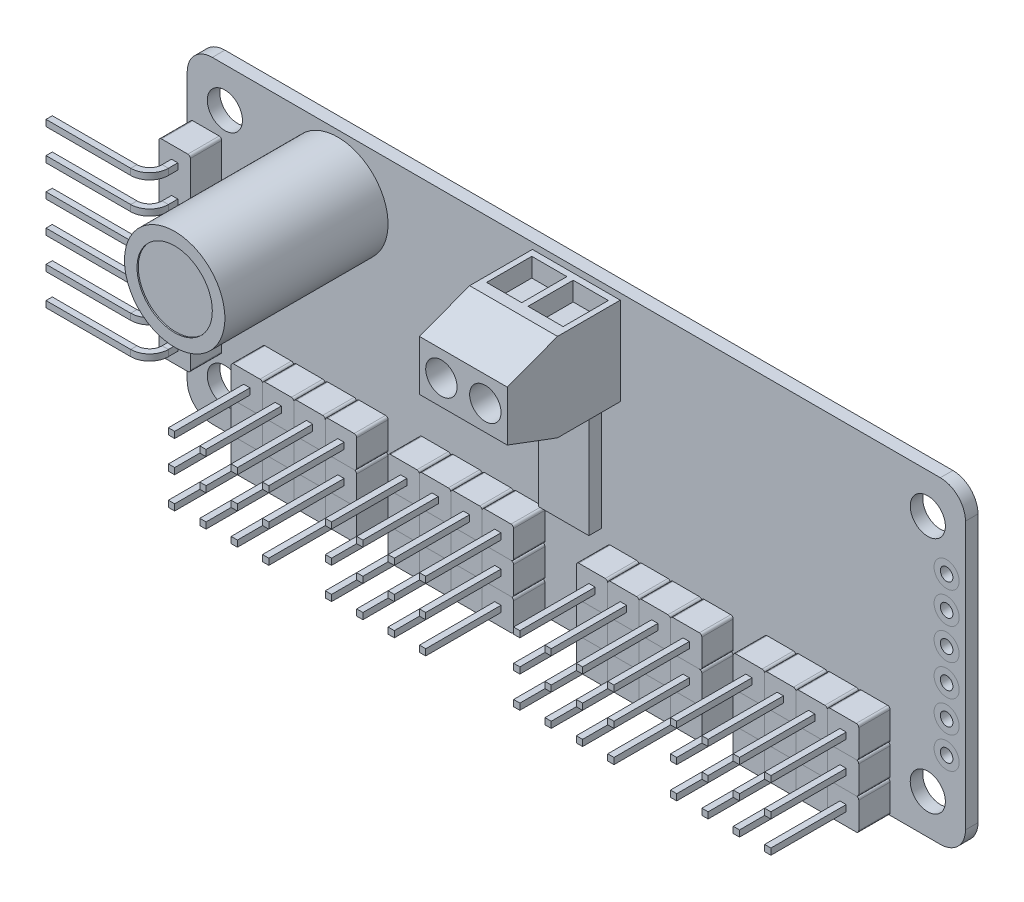
from build123d import *

# Parameters (mm, degrees)
SKETCH1_R           = 1.4
BOSS_EXTRUDE1_DEPTH = 1
BOSS_EXTRUDE2_DEPTH = 2.5
BOSS_EXTRUDE3_START = -27.5
BOSS_EXTRUDE3_DEPTH = 7
CUT_EXTRUDE1_DEPTH  = 2.5
CUT_EXTRUDE2_START  = 7.3
CUT_EXTRUDE2_DEPTH  = 0.2
SKETCH7_W           = 2.8
SKETCH7_H           = 3.6
CUT_EXTRUDE3_DEPTH  = 1.5
BOSS_EXTRUDE4_START = -4.5
SKETCH8_W           = 0.5
SKETCH8_H           = 0.5
BOSS_EXTRUDE4_DEPTH = 10.5
SKETCH9_W           = 4
SKETCH9_H           = 9
BOSS_EXTRUDE5_DEPTH = 1
SKETCH10_R          = 4
BOSS_EXTRUDE6_DEPTH = 13
SKETCH11_R          = 3
CUT_EXTRUDE4_DEPTH  = 0.1
BOSS_EXTRUDE7_DEPTH = 2.5
SKETCH14_W          = 0.5
SKETCH14_H          = 0.5
SKETCH15_R          = 0.5
CUT_EXTRUDE5_DEPTH  = 42.656602118


# Read off the part's stored shape, not the designer's step: Cut-Extrude2
with BuildPart() as part:
    # Sketch1 → Boss-Extrude1 (new body)
    with BuildSketch(Plane.XY):
        with BuildLine():
            Line((-29, -12.65), (29, -12.65))
            ThreePointArc((29, -12.65), (30.414213562, -12.064213562), (31, -10.65))
            Line((31, -10.65), (31, 10.65))
            ThreePointArc((31, 10.65), (30.414213562, 12.064213562), (29, 12.65))
            Line((29, 12.65), (-29, 12.65))
            ThreePointArc((-29, 12.65), (-30.414213562, 12.064213562), (-31, 10.65))
            Line((-31, 10.65), (-31, -10.65))
            ThreePointArc((-31, -10.65), (-30.414213562, -12.064213562), (-29, -12.65))
        make_face()
        with Locations((-28, 9.5)):
            Circle(SKETCH1_R, mode=Mode.SUBTRACT)
        with Locations((28, 9.5)):
            Circle(SKETCH1_R, mode=Mode.SUBTRACT)
        with Locations(Location((28, -9.5, 0), (0, 0, 180))):
            Circle(SKETCH1_R, mode=Mode.SUBTRACT)
        with Locations(Location((-28, -9.5, 0), (0, 0, 180))):
            Circle(SKETCH1_R, mode=Mode.SUBTRACT)
    extrude(amount=BOSS_EXTRUDE1_DEPTH)

    # Sketch2 → Boss-Extrude2 (add)
    with BuildSketch(Plane.XY.offset(1)):
        with BuildLine():
            ThreePointArc((-22.7, -5.15), (-22.558578644, -5.208578644), (-22.5, -5.35))
            Line((-22.5, -5.35), (-22.5, -7.45))
            ThreePointArc((-22.5, -7.45), (-22.558578644, -7.591421356), (-22.7, -7.65))
            Line((-22.7, -7.65), (-24.8, -7.65))
            ThreePointArc((-24.8, -7.65), (-24.941421356, -7.591421356), (-25, -7.45))
            Line((-25, -7.45), (-25, -5.35))
            ThreePointArc((-25, -5.35), (-24.941421356, -5.208578644), (-24.8, -5.15))
            Line((-24.8, -5.15), (-22.7, -5.15))
        make_face()
        with BuildLine():
            ThreePointArc((-20.2, -5.15), (-20.058578644, -5.208578644), (-20, -5.35))
            Line((-20, -5.35), (-20, -7.45))
            ThreePointArc((-20, -7.45), (-20.058578644, -7.591421356), (-20.2, -7.65))
            Line((-20.2, -7.65), (-22.3, -7.65))
            ThreePointArc((-22.3, -7.65), (-22.441421356, -7.591421356), (-22.5, -7.45))
            Line((-22.5, -7.45), (-22.5, -5.35))
            ThreePointArc((-22.5, -5.35), (-22.441421356, -5.208578644), (-22.3, -5.15))
            Line((-22.3, -5.15), (-20.2, -5.15))
        make_face()
        with BuildLine():
            ThreePointArc((-22.7, -7.65), (-22.558578644, -7.708578644), (-22.5, -7.85))
            Line((-22.5, -7.85), (-22.5, -9.95))
            ThreePointArc((-22.5, -9.95), (-22.558578644, -10.091421356), (-22.7, -10.15))
            Line((-22.7, -10.15), (-24.8, -10.15))
            ThreePointArc((-24.8, -10.15), (-24.941421356, -10.091421356), (-25, -9.95))
            Line((-25, -9.95), (-25, -7.85))
            ThreePointArc((-25, -7.85), (-24.941421356, -7.708578644), (-24.8, -7.65))
            Line((-24.8, -7.65), (-22.7, -7.65))
        make_face()
        with BuildLine():
            ThreePointArc((-20.2, -7.65), (-20.058578644, -7.708578644), (-20, -7.85))
            Line((-20, -7.85), (-20, -9.95))
            ThreePointArc((-20, -9.95), (-20.058578644, -10.091421356), (-20.2, -10.15))
            Line((-20.2, -10.15), (-22.3, -10.15))
            ThreePointArc((-22.3, -10.15), (-22.441421356, -10.091421356), (-22.5, -9.95))
            Line((-22.5, -9.95), (-22.5, -7.85))
            ThreePointArc((-22.5, -7.85), (-22.441421356, -7.708578644), (-22.3, -7.65))
            Line((-22.3, -7.65), (-20.2, -7.65))
        make_face()
        with BuildLine():
            ThreePointArc((-22.7, -12.65), (-22.558578644, -12.591421356), (-22.5, -12.45))
            Line((-22.5, -12.45), (-22.5, -10.35))
            ThreePointArc((-22.5, -10.35), (-22.558578644, -10.208578644), (-22.7, -10.15))
            Line((-22.7, -10.15), (-24.8, -10.15))
            ThreePointArc((-24.8, -10.15), (-24.941421356, -10.208578644), (-25, -10.35))
            Line((-25, -10.35), (-25, -12.45))
            ThreePointArc((-25, -12.45), (-24.941421356, -12.591421356), (-24.8, -12.65))
            Line((-24.8, -12.65), (-22.7, -12.65))
        make_face()
        with BuildLine():
            Line((-22.5, -10.35), (-22.5, -12.45))
            ThreePointArc((-22.5, -12.45), (-22.441421356, -12.591421356), (-22.3, -12.65))
            Line((-22.3, -12.65), (-20.2, -12.65))
            ThreePointArc((-20.2, -12.65), (-20.058578644, -12.591421356), (-20, -12.45))
            Line((-20, -12.45), (-20, -10.35))
            ThreePointArc((-20, -10.35), (-20.058578644, -10.208578644), (-20.2, -10.15))
            Line((-20.2, -10.15), (-22.3, -10.15))
            ThreePointArc((-22.3, -10.15), (-22.441421356, -10.208578644), (-22.5, -10.35))
        make_face()
        with BuildLine():
            Line((-20, -10.35), (-20, -12.45))
            ThreePointArc((-20, -12.45), (-19.941421356, -12.591421356), (-19.8, -12.65))
            Line((-19.8, -12.65), (-17.7, -12.65))
            ThreePointArc((-17.7, -12.65), (-17.558578644, -12.591421356), (-17.5, -12.45))
            Line((-17.5, -12.45), (-17.5, -10.35))
            ThreePointArc((-17.5, -10.35), (-17.558578644, -10.208578644), (-17.7, -10.15))
            Line((-17.7, -10.15), (-19.8, -10.15))
            ThreePointArc((-19.8, -10.15), (-19.941421356, -10.208578644), (-20, -10.35))
        make_face()
        with BuildLine():
            Line((-17.5, -10.35), (-17.5, -12.45))
            ThreePointArc((-17.5, -12.45), (-17.441421356, -12.591421356), (-17.3, -12.65))
            Line((-17.3, -12.65), (-15.2, -12.65))
            ThreePointArc((-15.2, -12.65), (-15.058578644, -12.591421356), (-15, -12.45))
            Line((-15, -12.45), (-15, -10.35))
            ThreePointArc((-15, -10.35), (-15.058578644, -10.208578644), (-15.2, -10.15))
            Line((-15.2, -10.15), (-17.3, -10.15))
            ThreePointArc((-17.3, -10.15), (-17.441421356, -10.208578644), (-17.5, -10.35))
        make_face()
        with BuildLine():
            ThreePointArc((-15.2, -7.65), (-15.058578644, -7.708578644), (-15, -7.85))
            Line((-15, -7.85), (-15, -9.95))
            ThreePointArc((-15, -9.95), (-15.058578644, -10.091421356), (-15.2, -10.15))
            Line((-15.2, -10.15), (-17.3, -10.15))
            ThreePointArc((-17.3, -10.15), (-17.441421356, -10.091421356), (-17.5, -9.95))
            Line((-17.5, -9.95), (-17.5, -7.85))
            ThreePointArc((-17.5, -7.85), (-17.441421356, -7.708578644), (-17.3, -7.65))
            Line((-17.3, -7.65), (-15.2, -7.65))
        make_face()
        with BuildLine():
            ThreePointArc((-17.7, -7.65), (-17.558578644, -7.708578644), (-17.5, -7.85))
            Line((-17.5, -7.85), (-17.5, -9.95))
            ThreePointArc((-17.5, -9.95), (-17.558578644, -10.091421356), (-17.7, -10.15))
            Line((-17.7, -10.15), (-19.8, -10.15))
            ThreePointArc((-19.8, -10.15), (-19.941421356, -10.091421356), (-20, -9.95))
            Line((-20, -9.95), (-20, -7.85))
            ThreePointArc((-20, -7.85), (-19.941421356, -7.708578644), (-19.8, -7.65))
            Line((-19.8, -7.65), (-17.7, -7.65))
        make_face()
        with BuildLine():
            ThreePointArc((-17.7, -5.15), (-17.558578644, -5.208578644), (-17.5, -5.35))
            Line((-17.5, -5.35), (-17.5, -7.45))
            ThreePointArc((-17.5, -7.45), (-17.558578644, -7.591421356), (-17.7, -7.65))
            Line((-17.7, -7.65), (-19.8, -7.65))
            ThreePointArc((-19.8, -7.65), (-19.941421356, -7.591421356), (-20, -7.45))
            Line((-20, -7.45), (-20, -5.35))
            ThreePointArc((-20, -5.35), (-19.941421356, -5.208578644), (-19.8, -5.15))
            Line((-19.8, -5.15), (-17.7, -5.15))
        make_face()
        with BuildLine():
            ThreePointArc((-15.2, -5.15), (-15.058578644, -5.208578644), (-15, -5.35))
            Line((-15, -5.35), (-15, -7.45))
            ThreePointArc((-15, -7.45), (-15.058578644, -7.591421356), (-15.2, -7.65))
            Line((-15.2, -7.65), (-17.3, -7.65))
            ThreePointArc((-17.3, -7.65), (-17.441421356, -7.591421356), (-17.5, -7.45))
            Line((-17.5, -7.45), (-17.5, -5.35))
            ThreePointArc((-17.5, -5.35), (-17.441421356, -5.208578644), (-17.3, -5.15))
            Line((-17.3, -5.15), (-15.2, -5.15))
        make_face()
        with BuildLine():
            Line((-10, -7.45), (-10, -5.35))
            ThreePointArc((-10, -5.35), (-10.058578644, -5.208578644), (-10.2, -5.15))
            Line((-10.2, -5.15), (-12.3, -5.15))
            ThreePointArc((-12.3, -5.15), (-12.441421356, -5.208578644), (-12.5, -5.35))
            Line((-12.5, -5.35), (-12.5, -7.45))
            ThreePointArc((-12.5, -7.45), (-12.441421356, -7.591421356), (-12.3, -7.65))
            Line((-12.3, -7.65), (-10.2, -7.65))
            ThreePointArc((-10.2, -7.65), (-10.058578644, -7.591421356), (-10, -7.45))
        make_face()
        with BuildLine():
            Line((-10, -9.95), (-10, -7.85))
            ThreePointArc((-10, -7.85), (-10.058578644, -7.708578644), (-10.2, -7.65))
            Line((-10.2, -7.65), (-12.3, -7.65))
            ThreePointArc((-12.3, -7.65), (-12.441421356, -7.708578644), (-12.5, -7.85))
            Line((-12.5, -7.85), (-12.5, -9.95))
            ThreePointArc((-12.5, -9.95), (-12.441421356, -10.091421356), (-12.3, -10.15))
            Line((-12.3, -10.15), (-10.2, -10.15))
            ThreePointArc((-10.2, -10.15), (-10.058578644, -10.091421356), (-10, -9.95))
        make_face()
        with BuildLine():
            ThreePointArc((-12.5, -12.45), (-12.441421356, -12.591421356), (-12.3, -12.65))
            Line((-12.3, -12.65), (-10.2, -12.65))
            ThreePointArc((-10.2, -12.65), (-10.058578644, -12.591421356), (-10, -12.45))
            Line((-10, -12.45), (-10, -10.35))
            ThreePointArc((-10, -10.35), (-10.058578644, -10.208578644), (-10.2, -10.15))
            Line((-10.2, -10.15), (-12.3, -10.15))
            ThreePointArc((-12.3, -10.15), (-12.441421356, -10.208578644), (-12.5, -10.35))
            Line((-12.5, -10.35), (-12.5, -12.45))
        make_face()
        with BuildLine():
            Line((-10, -10.35), (-10, -12.45))
            ThreePointArc((-10, -12.45), (-9.941421356, -12.591421356), (-9.8, -12.65))
            Line((-9.8, -12.65), (-7.7, -12.65))
            ThreePointArc((-7.7, -12.65), (-7.558578644, -12.591421356), (-7.5, -12.45))
            Line((-7.5, -12.45), (-7.5, -10.35))
            ThreePointArc((-7.5, -10.35), (-7.558578644, -10.208578644), (-7.7, -10.15))
            Line((-7.7, -10.15), (-9.8, -10.15))
            ThreePointArc((-9.8, -10.15), (-9.941421356, -10.208578644), (-10, -10.35))
        make_face()
        with BuildLine():
            Line((-7.5, -10.35), (-7.5, -12.45))
            ThreePointArc((-7.5, -12.45), (-7.441421356, -12.591421356), (-7.3, -12.65))
            Line((-7.3, -12.65), (-5.2, -12.65))
            ThreePointArc((-5.2, -12.65), (-5.058578644, -12.591421356), (-5, -12.45))
            Line((-5, -12.45), (-5, -10.35))
            ThreePointArc((-5, -10.35), (-5.058578644, -10.208578644), (-5.2, -10.15))
            Line((-5.2, -10.15), (-7.3, -10.15))
            ThreePointArc((-7.3, -10.15), (-7.441421356, -10.208578644), (-7.5, -10.35))
        make_face()
        with BuildLine():
            Line((-5, -10.35), (-5, -12.45))
            ThreePointArc((-5, -12.45), (-4.941421356, -12.591421356), (-4.8, -12.65))
            Line((-4.8, -12.65), (-2.7, -12.65))
            ThreePointArc((-2.7, -12.65), (-2.558578644, -12.591421356), (-2.5, -12.45))
            Line((-2.5, -12.45), (-2.5, -10.35))
            ThreePointArc((-2.5, -10.35), (-2.558578644, -10.208578644), (-2.7, -10.15))
            Line((-2.7, -10.15), (-4.8, -10.15))
            ThreePointArc((-4.8, -10.15), (-4.941421356, -10.208578644), (-5, -10.35))
        make_face()
        with BuildLine():
            Line((-2.5, -9.95), (-2.5, -7.85))
            ThreePointArc((-2.5, -7.85), (-2.558578644, -7.708578644), (-2.7, -7.65))
            Line((-2.7, -7.65), (-4.8, -7.65))
            ThreePointArc((-4.8, -7.65), (-4.941421356, -7.708578644), (-5, -7.85))
            Line((-5, -7.85), (-5, -9.95))
            ThreePointArc((-5, -9.95), (-4.941421356, -10.091421356), (-4.8, -10.15))
            Line((-4.8, -10.15), (-2.7, -10.15))
            ThreePointArc((-2.7, -10.15), (-2.558578644, -10.091421356), (-2.5, -9.95))
        make_face()
        with BuildLine():
            Line((-5, -9.95), (-5, -7.85))
            ThreePointArc((-5, -7.85), (-5.058578644, -7.708578644), (-5.2, -7.65))
            Line((-5.2, -7.65), (-7.3, -7.65))
            ThreePointArc((-7.3, -7.65), (-7.441421356, -7.708578644), (-7.5, -7.85))
            Line((-7.5, -7.85), (-7.5, -9.95))
            ThreePointArc((-7.5, -9.95), (-7.441421356, -10.091421356), (-7.3, -10.15))
            Line((-7.3, -10.15), (-5.2, -10.15))
            ThreePointArc((-5.2, -10.15), (-5.058578644, -10.091421356), (-5, -9.95))
        make_face()
        with BuildLine():
            Line((-7.5, -9.95), (-7.5, -7.85))
            ThreePointArc((-7.5, -7.85), (-7.558578644, -7.708578644), (-7.7, -7.65))
            Line((-7.7, -7.65), (-9.8, -7.65))
            ThreePointArc((-9.8, -7.65), (-9.941421356, -7.708578644), (-10, -7.85))
            Line((-10, -7.85), (-10, -9.95))
            ThreePointArc((-10, -9.95), (-9.941421356, -10.091421356), (-9.8, -10.15))
            Line((-9.8, -10.15), (-7.7, -10.15))
            ThreePointArc((-7.7, -10.15), (-7.558578644, -10.091421356), (-7.5, -9.95))
        make_face()
        with BuildLine():
            Line((-7.5, -7.45), (-7.5, -5.35))
            ThreePointArc((-7.5, -5.35), (-7.558578644, -5.208578644), (-7.7, -5.15))
            Line((-7.7, -5.15), (-9.8, -5.15))
            ThreePointArc((-9.8, -5.15), (-9.941421356, -5.208578644), (-10, -5.35))
            Line((-10, -5.35), (-10, -7.45))
            ThreePointArc((-10, -7.45), (-9.941421356, -7.591421356), (-9.8, -7.65))
            Line((-9.8, -7.65), (-7.7, -7.65))
            ThreePointArc((-7.7, -7.65), (-7.558578644, -7.591421356), (-7.5, -7.45))
        make_face()
        with BuildLine():
            Line((-5, -7.45), (-5, -5.35))
            ThreePointArc((-5, -5.35), (-5.058578644, -5.208578644), (-5.2, -5.15))
            Line((-5.2, -5.15), (-7.3, -5.15))
            ThreePointArc((-7.3, -5.15), (-7.441421356, -5.208578644), (-7.5, -5.35))
            Line((-7.5, -5.35), (-7.5, -7.45))
            ThreePointArc((-7.5, -7.45), (-7.441421356, -7.591421356), (-7.3, -7.65))
            Line((-7.3, -7.65), (-5.2, -7.65))
            ThreePointArc((-5.2, -7.65), (-5.058578644, -7.591421356), (-5, -7.45))
        make_face()
        with BuildLine():
            Line((-2.5, -7.45), (-2.5, -5.35))
            ThreePointArc((-2.5, -5.35), (-2.558578644, -5.208578644), (-2.7, -5.15))
            Line((-2.7, -5.15), (-4.8, -5.15))
            ThreePointArc((-4.8, -5.15), (-4.941421356, -5.208578644), (-5, -5.35))
            Line((-5, -5.35), (-5, -7.45))
            ThreePointArc((-5, -7.45), (-4.941421356, -7.591421356), (-4.8, -7.65))
            Line((-4.8, -7.65), (-2.7, -7.65))
            ThreePointArc((-2.7, -7.65), (-2.558578644, -7.591421356), (-2.5, -7.45))
        make_face()
        with BuildLine():
            ThreePointArc((4.8, -5.15), (4.941421356, -5.208578644), (5, -5.35))
            Line((5, -5.35), (5, -7.45))
            ThreePointArc((5, -7.45), (4.941421356, -7.591421356), (4.8, -7.65))
            Line((4.8, -7.65), (2.7, -7.65))
            ThreePointArc((2.7, -7.65), (2.558578644, -7.591421356), (2.5, -7.45))
            Line((2.5, -7.45), (2.5, -5.35))
            ThreePointArc((2.5, -5.35), (2.558578644, -5.208578644), (2.7, -5.15))
            Line((2.7, -5.15), (4.8, -5.15))
        make_face()
        with BuildLine():
            ThreePointArc((7.3, -5.15), (7.441421356, -5.208578644), (7.5, -5.35))
            Line((7.5, -5.35), (7.5, -7.45))
            ThreePointArc((7.5, -7.45), (7.441421356, -7.591421356), (7.3, -7.65))
            Line((7.3, -7.65), (5.2, -7.65))
            ThreePointArc((5.2, -7.65), (5.058578644, -7.591421356), (5, -7.45))
            Line((5, -7.45), (5, -5.35))
            ThreePointArc((5, -5.35), (5.058578644, -5.208578644), (5.2, -5.15))
            Line((5.2, -5.15), (7.3, -5.15))
        make_face()
        with BuildLine():
            ThreePointArc((9.8, -5.15), (9.941421356, -5.208578644), (10, -5.35))
            Line((10, -5.35), (10, -7.45))
            ThreePointArc((10, -7.45), (9.941421356, -7.591421356), (9.8, -7.65))
            Line((9.8, -7.65), (7.7, -7.65))
            ThreePointArc((7.7, -7.65), (7.558578644, -7.591421356), (7.5, -7.45))
            Line((7.5, -7.45), (7.5, -5.35))
            ThreePointArc((7.5, -5.35), (7.558578644, -5.208578644), (7.7, -5.15))
            Line((7.7, -5.15), (9.8, -5.15))
        make_face()
        with BuildLine():
            ThreePointArc((12.3, -5.15), (12.441421356, -5.208578644), (12.5, -5.35))
            Line((12.5, -5.35), (12.5, -7.45))
            ThreePointArc((12.5, -7.45), (12.441421356, -7.591421356), (12.3, -7.65))
            Line((12.3, -7.65), (10.2, -7.65))
            ThreePointArc((10.2, -7.65), (10.058578644, -7.591421356), (10, -7.45))
            Line((10, -7.45), (10, -5.35))
            ThreePointArc((10, -5.35), (10.058578644, -5.208578644), (10.2, -5.15))
            Line((10.2, -5.15), (12.3, -5.15))
        make_face()
        with BuildLine():
            ThreePointArc((12.3, -7.65), (12.441421356, -7.708578644), (12.5, -7.85))
            Line((12.5, -7.85), (12.5, -9.95))
            ThreePointArc((12.5, -9.95), (12.441421356, -10.091421356), (12.3, -10.15))
            Line((12.3, -10.15), (10.2, -10.15))
            ThreePointArc((10.2, -10.15), (10.058578644, -10.091421356), (10, -9.95))
            Line((10, -9.95), (10, -7.85))
            ThreePointArc((10, -7.85), (10.058578644, -7.708578644), (10.2, -7.65))
            Line((10.2, -7.65), (12.3, -7.65))
        make_face()
        with BuildLine():
            Line((10, -10.35), (10, -12.45))
            ThreePointArc((10, -12.45), (10.058578644, -12.591421356), (10.2, -12.65))
            Line((10.2, -12.65), (12.3, -12.65))
            ThreePointArc((12.3, -12.65), (12.441421356, -12.591421356), (12.5, -12.45))
            Line((12.5, -12.45), (12.5, -10.35))
            ThreePointArc((12.5, -10.35), (12.441421356, -10.208578644), (12.3, -10.15))
            Line((12.3, -10.15), (10.2, -10.15))
            ThreePointArc((10.2, -10.15), (10.058578644, -10.208578644), (10, -10.35))
        make_face()
        with BuildLine():
            Line((7.5, -10.35), (7.5, -12.45))
            ThreePointArc((7.5, -12.45), (7.558578644, -12.591421356), (7.7, -12.65))
            Line((7.7, -12.65), (9.8, -12.65))
            ThreePointArc((9.8, -12.65), (9.941421356, -12.591421356), (10, -12.45))
            Line((10, -12.45), (10, -10.35))
            ThreePointArc((10, -10.35), (9.941421356, -10.208578644), (9.8, -10.15))
            Line((9.8, -10.15), (7.7, -10.15))
            ThreePointArc((7.7, -10.15), (7.558578644, -10.208578644), (7.5, -10.35))
        make_face()
        with BuildLine():
            Line((5, -10.35), (5, -12.45))
            ThreePointArc((5, -12.45), (5.058578644, -12.591421356), (5.2, -12.65))
            Line((5.2, -12.65), (7.3, -12.65))
            ThreePointArc((7.3, -12.65), (7.441421356, -12.591421356), (7.5, -12.45))
            Line((7.5, -12.45), (7.5, -10.35))
            ThreePointArc((7.5, -10.35), (7.441421356, -10.208578644), (7.3, -10.15))
            Line((7.3, -10.15), (5.2, -10.15))
            ThreePointArc((5.2, -10.15), (5.058578644, -10.208578644), (5, -10.35))
        make_face()
        with BuildLine():
            ThreePointArc((2.5, -12.45), (2.558578644, -12.591421356), (2.7, -12.65))
            Line((2.7, -12.65), (4.8, -12.65))
            ThreePointArc((4.8, -12.65), (4.941421356, -12.591421356), (5, -12.45))
            Line((5, -12.45), (5, -10.35))
            ThreePointArc((5, -10.35), (4.941421356, -10.208578644), (4.8, -10.15))
            Line((4.8, -10.15), (2.7, -10.15))
            ThreePointArc((2.7, -10.15), (2.558578644, -10.208578644), (2.5, -10.35))
            Line((2.5, -10.35), (2.5, -12.45))
        make_face()
        with BuildLine():
            ThreePointArc((4.8, -7.65), (4.941421356, -7.708578644), (5, -7.85))
            Line((5, -7.85), (5, -9.95))
            ThreePointArc((5, -9.95), (4.941421356, -10.091421356), (4.8, -10.15))
            Line((4.8, -10.15), (2.7, -10.15))
            ThreePointArc((2.7, -10.15), (2.558578644, -10.091421356), (2.5, -9.95))
            Line((2.5, -9.95), (2.5, -7.85))
            ThreePointArc((2.5, -7.85), (2.558578644, -7.708578644), (2.7, -7.65))
            Line((2.7, -7.65), (4.8, -7.65))
        make_face()
        with BuildLine():
            ThreePointArc((7.3, -7.65), (7.441421356, -7.708578644), (7.5, -7.85))
            Line((7.5, -7.85), (7.5, -9.95))
            ThreePointArc((7.5, -9.95), (7.441421356, -10.091421356), (7.3, -10.15))
            Line((7.3, -10.15), (5.2, -10.15))
            ThreePointArc((5.2, -10.15), (5.058578644, -10.091421356), (5, -9.95))
            Line((5, -9.95), (5, -7.85))
            ThreePointArc((5, -7.85), (5.058578644, -7.708578644), (5.2, -7.65))
            Line((5.2, -7.65), (7.3, -7.65))
        make_face()
        with BuildLine():
            ThreePointArc((9.8, -7.65), (9.941421356, -7.708578644), (10, -7.85))
            Line((10, -7.85), (10, -9.95))
            ThreePointArc((10, -9.95), (9.941421356, -10.091421356), (9.8, -10.15))
            Line((9.8, -10.15), (7.7, -10.15))
            ThreePointArc((7.7, -10.15), (7.558578644, -10.091421356), (7.5, -9.95))
            Line((7.5, -9.95), (7.5, -7.85))
            ThreePointArc((7.5, -7.85), (7.558578644, -7.708578644), (7.7, -7.65))
            Line((7.7, -7.65), (9.8, -7.65))
        make_face()
        with BuildLine():
            ThreePointArc((15, -12.45), (15.058578644, -12.591421356), (15.2, -12.65))
            Line((15.2, -12.65), (17.3, -12.65))
            ThreePointArc((17.3, -12.65), (17.441421356, -12.591421356), (17.5, -12.45))
            Line((17.5, -12.45), (17.5, -10.35))
            ThreePointArc((17.5, -10.35), (17.441421356, -10.208578644), (17.3, -10.15))
            Line((17.3, -10.15), (15.2, -10.15))
            ThreePointArc((15.2, -10.15), (15.058578644, -10.208578644), (15, -10.35))
            Line((15, -10.35), (15, -12.45))
        make_face()
        with BuildLine():
            Line((17.5, -10.35), (17.5, -12.45))
            ThreePointArc((17.5, -12.45), (17.558578644, -12.591421356), (17.7, -12.65))
            Line((17.7, -12.65), (19.8, -12.65))
            ThreePointArc((19.8, -12.65), (19.941421356, -12.591421356), (20, -12.45))
            Line((20, -12.45), (20, -10.35))
            ThreePointArc((20, -10.35), (19.941421356, -10.208578644), (19.8, -10.15))
            Line((19.8, -10.15), (17.7, -10.15))
            ThreePointArc((17.7, -10.15), (17.558578644, -10.208578644), (17.5, -10.35))
        make_face()
        with BuildLine():
            Line((20, -10.35), (20, -12.45))
            ThreePointArc((20, -12.45), (20.058578644, -12.591421356), (20.2, -12.65))
            Line((20.2, -12.65), (22.3, -12.65))
            ThreePointArc((22.3, -12.65), (22.441421356, -12.591421356), (22.5, -12.45))
            Line((22.5, -12.45), (22.5, -10.35))
            ThreePointArc((22.5, -10.35), (22.441421356, -10.208578644), (22.3, -10.15))
            Line((22.3, -10.15), (20.2, -10.15))
            ThreePointArc((20.2, -10.15), (20.058578644, -10.208578644), (20, -10.35))
        make_face()
        with BuildLine():
            Line((22.5, -9.95), (22.5, -7.85))
            ThreePointArc((22.5, -7.85), (22.441421356, -7.708578644), (22.3, -7.65))
            Line((22.3, -7.65), (20.2, -7.65))
            ThreePointArc((20.2, -7.65), (20.058578644, -7.708578644), (20, -7.85))
            Line((20, -7.85), (20, -9.95))
            ThreePointArc((20, -9.95), (20.058578644, -10.091421356), (20.2, -10.15))
            Line((20.2, -10.15), (22.3, -10.15))
            ThreePointArc((22.3, -10.15), (22.441421356, -10.091421356), (22.5, -9.95))
        make_face()
        with BuildLine():
            Line((20, -9.95), (20, -7.85))
            ThreePointArc((20, -7.85), (19.941421356, -7.708578644), (19.8, -7.65))
            Line((19.8, -7.65), (17.7, -7.65))
            ThreePointArc((17.7, -7.65), (17.558578644, -7.708578644), (17.5, -7.85))
            Line((17.5, -7.85), (17.5, -9.95))
            ThreePointArc((17.5, -9.95), (17.558578644, -10.091421356), (17.7, -10.15))
            Line((17.7, -10.15), (19.8, -10.15))
            ThreePointArc((19.8, -10.15), (19.941421356, -10.091421356), (20, -9.95))
        make_face()
        with BuildLine():
            Line((17.5, -9.95), (17.5, -7.85))
            ThreePointArc((17.5, -7.85), (17.441421356, -7.708578644), (17.3, -7.65))
            Line((17.3, -7.65), (15.2, -7.65))
            ThreePointArc((15.2, -7.65), (15.058578644, -7.708578644), (15, -7.85))
            Line((15, -7.85), (15, -9.95))
            ThreePointArc((15, -9.95), (15.058578644, -10.091421356), (15.2, -10.15))
            Line((15.2, -10.15), (17.3, -10.15))
            ThreePointArc((17.3, -10.15), (17.441421356, -10.091421356), (17.5, -9.95))
        make_face()
        with BuildLine():
            Line((17.5, -7.45), (17.5, -5.35))
            ThreePointArc((17.5, -5.35), (17.441421356, -5.208578644), (17.3, -5.15))
            Line((17.3, -5.15), (15.2, -5.15))
            ThreePointArc((15.2, -5.15), (15.058578644, -5.208578644), (15, -5.35))
            Line((15, -5.35), (15, -7.45))
            ThreePointArc((15, -7.45), (15.058578644, -7.591421356), (15.2, -7.65))
            Line((15.2, -7.65), (17.3, -7.65))
            ThreePointArc((17.3, -7.65), (17.441421356, -7.591421356), (17.5, -7.45))
        make_face()
        with BuildLine():
            Line((20, -7.45), (20, -5.35))
            ThreePointArc((20, -5.35), (19.941421356, -5.208578644), (19.8, -5.15))
            Line((19.8, -5.15), (17.7, -5.15))
            ThreePointArc((17.7, -5.15), (17.558578644, -5.208578644), (17.5, -5.35))
            Line((17.5, -5.35), (17.5, -7.45))
            ThreePointArc((17.5, -7.45), (17.558578644, -7.591421356), (17.7, -7.65))
            Line((17.7, -7.65), (19.8, -7.65))
            ThreePointArc((19.8, -7.65), (19.941421356, -7.591421356), (20, -7.45))
        make_face()
        with BuildLine():
            Line((22.5, -7.45), (22.5, -5.35))
            ThreePointArc((22.5, -5.35), (22.441421356, -5.208578644), (22.3, -5.15))
            Line((22.3, -5.15), (20.2, -5.15))
            ThreePointArc((20.2, -5.15), (20.058578644, -5.208578644), (20, -5.35))
            Line((20, -5.35), (20, -7.45))
            ThreePointArc((20, -7.45), (20.058578644, -7.591421356), (20.2, -7.65))
            Line((20.2, -7.65), (22.3, -7.65))
            ThreePointArc((22.3, -7.65), (22.441421356, -7.591421356), (22.5, -7.45))
        make_face()
        with BuildLine():
            Line((25, -7.45), (25, -5.35))
            ThreePointArc((25, -5.35), (24.941421356, -5.208578644), (24.8, -5.15))
            Line((24.8, -5.15), (22.7, -5.15))
            ThreePointArc((22.7, -5.15), (22.558578644, -5.208578644), (22.5, -5.35))
            Line((22.5, -5.35), (22.5, -7.45))
            ThreePointArc((22.5, -7.45), (22.558578644, -7.591421356), (22.7, -7.65))
            Line((22.7, -7.65), (24.8, -7.65))
            ThreePointArc((24.8, -7.65), (24.941421356, -7.591421356), (25, -7.45))
        make_face()
        with BuildLine():
            Line((25, -9.95), (25, -7.85))
            ThreePointArc((25, -7.85), (24.941421356, -7.708578644), (24.8, -7.65))
            Line((24.8, -7.65), (22.7, -7.65))
            ThreePointArc((22.7, -7.65), (22.558578644, -7.708578644), (22.5, -7.85))
            Line((22.5, -7.85), (22.5, -9.95))
            ThreePointArc((22.5, -9.95), (22.558578644, -10.091421356), (22.7, -10.15))
            Line((22.7, -10.15), (24.8, -10.15))
            ThreePointArc((24.8, -10.15), (24.941421356, -10.091421356), (25, -9.95))
        make_face()
        with BuildLine():
            Line((22.5, -10.35), (22.5, -12.45))
            ThreePointArc((22.5, -12.45), (22.558578644, -12.591421356), (22.7, -12.65))
            Line((22.7, -12.65), (24.8, -12.65))
            ThreePointArc((24.8, -12.65), (24.941421356, -12.591421356), (25, -12.45))
            Line((25, -12.45), (25, -10.35))
            ThreePointArc((25, -10.35), (24.941421356, -10.208578644), (24.8, -10.15))
            Line((24.8, -10.15), (22.7, -10.15))
            ThreePointArc((22.7, -10.15), (22.558578644, -10.208578644), (22.5, -10.35))
        make_face()
    extrude(amount=BOSS_EXTRUDE2_DEPTH)

    # Sketch5 → Boss-Extrude3 (add)
    with BuildSketch(Plane.ZY.offset(31).offset(BOSS_EXTRUDE3_START)):
        Polygon((1, 12.15), (6, 12.15), (10, 10.65), (10, 6.65), (6, 5.15), (1, 5.15), align=None)
    extrude(amount=-BOSS_EXTRUDE3_DEPTH)

    # Sketch6 → Cut-Extrude1 (cut)
    with BuildSketch(Plane.XY.offset(10)):
        with BuildLine():
            ThreePointArc((-0.516103732, 8.85), (-1.75, 9.9), (-2.983896268, 8.85))
            Line((-2.983896268, 8.85), (-0.516103732, 8.85))
        make_face()
        with BuildLine():
            ThreePointArc((-2.983896268, 8.85), (-3, 8.65), (-2.983896268, 8.45))
            Line((-2.983896268, 8.45), (-0.516103732, 8.45))
            ThreePointArc((-0.516103732, 8.45), (-0.504032437, 8.549676361), (-0.5, 8.65))
            ThreePointArc((-0.5, 8.65), (-0.504032437, 8.750323639), (-0.516103732, 8.85))
            Line((-0.516103732, 8.85), (-2.983896268, 8.85))
        make_face()
        with BuildLine():
            Line((-0.516103732, 8.45), (-2.983896268, 8.45))
            ThreePointArc((-2.983896268, 8.45), (-1.75, 7.4), (-0.516103732, 8.45))
        make_face()
        with BuildLine():
            Line((2.983896268, 8.45), (0.516103732, 8.45))
            ThreePointArc((0.516103732, 8.45), (1.75, 7.4), (2.983896268, 8.45))
        make_face()
        with BuildLine():
            ThreePointArc((0.516103732, 8.85), (0.5, 8.65), (0.516103732, 8.45))
            Line((0.516103732, 8.45), (2.983896268, 8.45))
            ThreePointArc((2.983896268, 8.45), (2.995967563, 8.549676361), (3, 8.65))
            ThreePointArc((3, 8.65), (2.995967563, 8.750323639), (2.983896268, 8.85))
            Line((2.983896268, 8.85), (0.516103732, 8.85))
        make_face()
        with BuildLine():
            ThreePointArc((2.983896268, 8.85), (1.75, 9.9), (0.516103732, 8.85))
            Line((0.516103732, 8.85), (2.983896268, 8.85))
        make_face()
    extrude(amount=-CUT_EXTRUDE1_DEPTH, mode=Mode.SUBTRACT)

    # Cut-Extrude2 outline → Cut-Extrude2 (cut)
    with BuildSketch(Plane.XY.offset(CUT_EXTRUDE2_START)):
        with BuildLine():
            Line((-0.516103732, 8.85), (-2.983896268, 8.85))
            ThreePointArc((-2.983896268, 8.85), (-3, 8.65), (-2.983896268, 8.45))
            Line((-2.983896268, 8.45), (-0.516103732, 8.45))
            ThreePointArc((-0.516103732, 8.45), (-0.5, 8.65), (-0.516103732, 8.85))
        make_face()
        with BuildLine():
            Line((2.983896268, 8.85), (0.516103732, 8.85))
            ThreePointArc((0.516103732, 8.85), (0.5, 8.65), (0.516103732, 8.45))
            Line((0.516103732, 8.45), (2.983896268, 8.45))
            ThreePointArc((2.983896268, 8.45), (3, 8.65), (2.983896268, 8.85))
        make_face()
    extrude(amount=CUT_EXTRUDE2_DEPTH, mode=Mode.SUBTRACT)

    # Sketch7 → Cut-Extrude3 (cut)
    with BuildSketch(Plane(origin=(0, 12.15, 0), x_dir=(1, 0, 0), z_dir=(0, 1, 0))):
        with Locations((-1.65, -3.3)):
            Rectangle(SKETCH7_W, SKETCH7_H)
        with Locations((1.65, -3.3)):
            Rectangle(SKETCH7_W, SKETCH7_H)
    extrude(amount=-CUT_EXTRUDE3_DEPTH, mode=Mode.SUBTRACT)

    # Sketch8 → Boss-Extrude4 (add)
    with BuildSketch(Plane.XY.offset(3.5).offset(BOSS_EXTRUDE4_START)):
        with Locations((-23.75, -11.4)):
            Rectangle(SKETCH8_W, SKETCH8_H)
        with Locations((-21.25, -11.4)):
            Rectangle(SKETCH8_W, SKETCH8_H)
        with Locations((-18.75, -11.4)):
            Rectangle(SKETCH8_W, SKETCH8_H)
        with Locations((-16.25, -11.4)):
            Rectangle(SKETCH8_W, SKETCH8_H)
        with Locations((-21.25, -8.9)):
            Rectangle(SKETCH8_W, SKETCH8_H)
        with Locations((-18.75, -8.9)):
            Rectangle(SKETCH8_W, SKETCH8_H)
        with Locations((-16.25, -8.9)):
            Rectangle(SKETCH8_W, SKETCH8_H)
        with Locations((-21.25, -6.4)):
            Rectangle(SKETCH8_W, SKETCH8_H)
        with Locations((-18.75, -6.4)):
            Rectangle(SKETCH8_W, SKETCH8_H)
        with Locations((-16.25, -6.4)):
            Rectangle(SKETCH8_W, SKETCH8_H)
        with Locations((-23.75, -8.9)):
            Rectangle(SKETCH8_W, SKETCH8_H)
        with Locations((-23.75, -6.4)):
            Rectangle(SKETCH8_W, SKETCH8_H)
        with Locations((-3.75, -6.4)):
            Rectangle(SKETCH8_W, SKETCH8_H)
        with Locations((-3.75, -8.9)):
            Rectangle(SKETCH8_W, SKETCH8_H)
        with Locations((-11.25, -6.4)):
            Rectangle(SKETCH8_W, SKETCH8_H)
        with Locations((-8.75, -6.4)):
            Rectangle(SKETCH8_W, SKETCH8_H)
        with Locations((-6.25, -6.4)):
            Rectangle(SKETCH8_W, SKETCH8_H)
        with Locations((-11.25, -8.9)):
            Rectangle(SKETCH8_W, SKETCH8_H)
        with Locations((-8.75, -8.9)):
            Rectangle(SKETCH8_W, SKETCH8_H)
        with Locations((-6.25, -8.9)):
            Rectangle(SKETCH8_W, SKETCH8_H)
        with Locations((-11.25, -11.4)):
            Rectangle(SKETCH8_W, SKETCH8_H)
        with Locations((-8.75, -11.4)):
            Rectangle(SKETCH8_W, SKETCH8_H)
        with Locations((-6.25, -11.4)):
            Rectangle(SKETCH8_W, SKETCH8_H)
        with Locations((-3.75, -11.4)):
            Rectangle(SKETCH8_W, SKETCH8_H)
    boss_extrude4 = extrude(amount=BOSS_EXTRUDE4_DEPTH)

    # Mirror1: Boss-Extrude4 across plane
    add(boss_extrude4.mirror(Plane(origin=(0, 0, 0), x_dir=(0, 0, 1), z_dir=(1, 0, 0))))

    # Sketch9 → Boss-Extrude5 (add)
    with BuildSketch(Plane.XY.offset(1)):
        with Locations((0, 0.15)):
            Rectangle(SKETCH9_W, SKETCH9_H)
    extrude(amount=BOSS_EXTRUDE5_DEPTH)

    # Sketch10 → Boss-Extrude6 (add)
    with BuildSketch(Plane.XY.offset(1)):
        with Locations(Location((-19, 8.15, 0), (0, 0, 180))):
            Circle(SKETCH10_R)
    extrude(amount=BOSS_EXTRUDE6_DEPTH)

    # Sketch11 → Cut-Extrude4 (cut)
    with BuildSketch(Plane.XY.offset(14)):
        with Locations((-19, 8.15)):
            Circle(SKETCH11_R)
    extrude(amount=-CUT_EXTRUDE4_DEPTH, mode=Mode.SUBTRACT)

    # Sketch12 → Boss-Extrude7 (add)
    with BuildSketch(Plane.XY.offset(1)):
        with BuildLine():
            Line((-30.55, -7.5), (-28.45, -7.5))
            ThreePointArc((-28.45, -7.5), (-28.308578644, -7.441421356), (-28.25, -7.3))
            Line((-28.25, -7.3), (-28.25, 7.3))
            ThreePointArc((-28.25, 7.3), (-28.308578644, 7.441421356), (-28.45, 7.5))
            Line((-28.45, 7.5), (-30.55, 7.5))
            ThreePointArc((-30.55, 7.5), (-30.691421356, 7.441421356), (-30.75, 7.3))
            Line((-30.75, 7.3), (-30.75, -7.3))
            ThreePointArc((-30.75, -7.3), (-30.691421356, -7.441421356), (-30.55, -7.5))
        make_face()
    extrude(amount=BOSS_EXTRUDE7_DEPTH)

    # Sweep1: sweep along a path in Sketch13
    with BuildLine(Plane.XZ.offset(7.5)) as sweep1_path:
        Line((-29.5, 3.5), (-29.5, 4.25))
        ThreePointArc((-29.5, 4.25), (-29.866116524, 5.133883476), (-30.75, 5.5))
        Line((-30.75, 5.5), (-37.5, 5.5))
    # Sketch14 → Sweep1 (sweep)
    with BuildSketch(Plane.XY.offset(3.5)):
        with Locations((-29.5, -6.25)):
            Rectangle(SKETCH14_W, SKETCH14_H)
        with Locations((-29.5, -3.75)):
            Rectangle(SKETCH14_W, SKETCH14_H)
        with Locations((-29.5, -1.25)):
            Rectangle(SKETCH14_W, SKETCH14_H)
        with Locations((-29.5, 1.25)):
            Rectangle(SKETCH14_W, SKETCH14_H)
        with Locations((-29.5, 3.75)):
            Rectangle(SKETCH14_W, SKETCH14_H)
        with Locations((-29.5, 6.25)):
            Rectangle(SKETCH14_W, SKETCH14_H)
    sweep(path=sweep1_path.line)

    # Sketch15 → Cut-Extrude5 (cut, through all)
    with BuildSketch(Plane.XY.offset(1)):
        with Locations((29.5, -6.25)):
            Circle(SKETCH15_R)
        with Locations((29.5, -3.75)):
            Circle(SKETCH15_R)
        with Locations((29.5, -1.25)):
            Circle(SKETCH15_R)
        with Locations((29.5, 1.25)):
            Circle(SKETCH15_R)
        with Locations((29.5, 3.75)):
            Circle(SKETCH15_R)
        with Locations((29.5, 6.25)):
            Circle(SKETCH15_R)
    extrude(amount=-CUT_EXTRUDE5_DEPTH, mode=Mode.SUBTRACT)


solid = part.part
